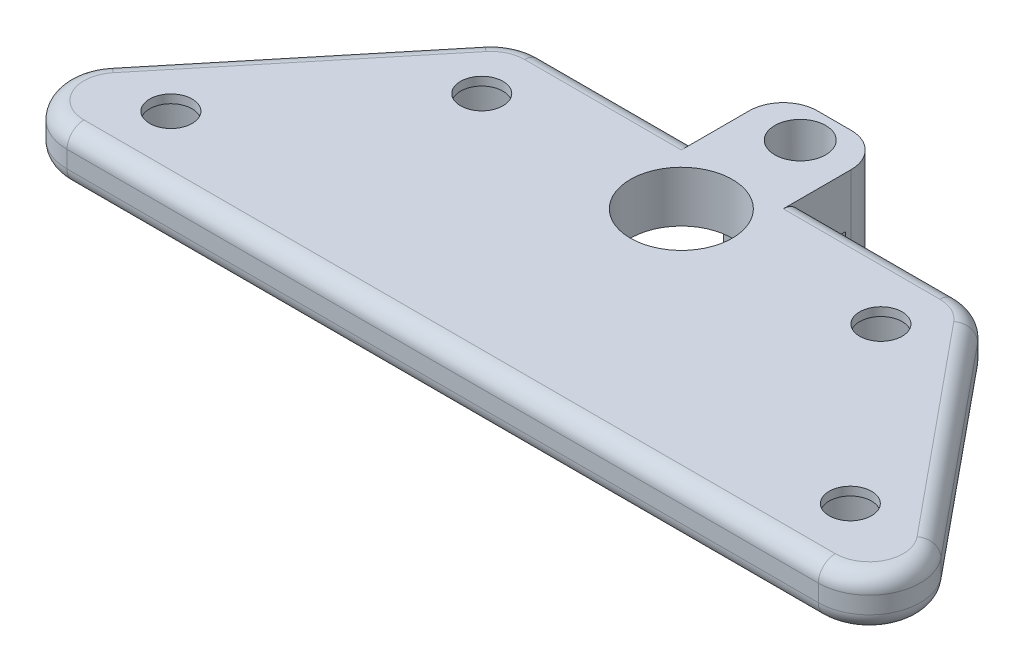
from build123d import *
from build123d.topology import SkipClean

# Parameters (mm, degrees)
SKETCH1_R           = 3
SKETCH1_R_2         = 2.6
SKETCH1_R_3         = 1.5
BOSS_EXTRUDE1_DEPTH = 3
BOSS_EXTRUDE3_START = -0.5
SKETCH3_R           = 2.6
SKETCH3_R_2         = 1.25
BOSS_EXTRUDE3_DEPTH = 0.5
BOSS_EXTRUDE4_START = 3.4
SKETCH4_R           = 1.5
BOSS_EXTRUDE4_DEPTH = 3.4
FILLET1_R           = 1
SKETCH5_R           = 11
CUT_EXTRUDE1_DEPTH  = 3.4


with BuildPart() as part:
    # Sketch1 → Boss-Extrude1 (new body)
    with BuildSketch(Plane(origin=(0, 0, 0), x_dir=(1, 0, 0), z_dir=(0, 1, 0))):
        with BuildLine():
            Line((-14.54167044, 2.903480135), (-24.433461485, -9.146519865))
            ThreePointArc((-24.433461485, -9.146519865), (-24.826727515, -12.332489687), (-22.114676593, -14.05))
            Line((-22.114676593, -14.05), (22.114676593, -14.05))
            ThreePointArc((22.114676593, -14.05), (24.826727515, -12.332489687), (24.433461485, -9.146519865))
            Line((24.433461485, -9.146519865), (14.54167044, 2.903480135))
            ThreePointArc((14.54167044, 2.903480135), (13.505375235, 3.712050922), (12.222885548, 4))
            Line((12.222885548, 4), (3, 4))
            Line((3, 4), (3, 7))
            ThreePointArc((3, 7), (2.414213562, 8.414213562), (1, 9))
            Line((1, 9), (-1, 9))
            ThreePointArc((-1, 9), (-2.414213562, 8.414213562), (-3, 7))
            Line((-3, 7), (-3, 4))
            Line((-3, 4), (-12.222885548, 4))
            ThreePointArc((-12.222885548, 4), (-13.505375235, 3.712050922), (-14.54167044, 2.903480135))
        make_face()
        with Locations(Location((0, 0, 0), (0, 0, 270))):
            Circle(SKETCH1_R, mode=Mode.SUBTRACT)
        with Locations(Location((11.75, 0, 0), (0, 0, 270))):
            Circle(SKETCH1_R_2, mode=Mode.SUBTRACT)
        with Locations(Location((20, -10.05, 0), (0, 0, 270))):
            Circle(SKETCH1_R_2, mode=Mode.SUBTRACT)
        with Locations(Location((-20, -10.05, 0), (0, 0, 90))):
            Circle(SKETCH1_R_2, mode=Mode.SUBTRACT)
        with Locations(Location((-11.75, 0, 0), (0, 0, 90))):
            Circle(SKETCH1_R_2, mode=Mode.SUBTRACT)
        with Locations(Location((0, 7, 0), (0, 0, 270))):
            Circle(SKETCH1_R_3, mode=Mode.SUBTRACT)
    extrude(amount=BOSS_EXTRUDE1_DEPTH)

    # Sketch3 → Boss-Extrude3 (add)
    # profile 1 of 4: a face of its own
    with BuildSketch(Plane(origin=(0, 3, 0), x_dir=(1, 0, 0), z_dir=(0, 1, 0)).offset(BOSS_EXTRUDE3_START)):
        with Locations(Location((-11.75, 0, 0), (0, 0, 90))):
            Circle(SKETCH3_R)
        with Locations(Location((-11.75, 0, 0), (0, 0, 270))):
            Circle(SKETCH3_R_2, mode=Mode.SUBTRACT)
    # profile 2 of 4: a face of its own
    with BuildSketch(Plane(origin=(0, 3, 0), x_dir=(1, 0, 0), z_dir=(0, 1, 0)).offset(BOSS_EXTRUDE3_START)):
        with Locations(Location((-20, -10.05, 0), (0, 0, 90))):
            Circle(SKETCH3_R)
        with Locations(Location((-20, -10.05, 0), (0, 0, 270))):
            Circle(SKETCH3_R_2, mode=Mode.SUBTRACT)
    # profile 3 of 4: a face of its own
    with BuildSketch(Plane(origin=(0, 3, 0), x_dir=(1, 0, 0), z_dir=(0, 1, 0)).offset(BOSS_EXTRUDE3_START)):
        with Locations(Location((11.75, 0, 0), (0, 0, 270))):
            Circle(SKETCH3_R)
        with Locations(Location((11.75, 0, 0), (0, 0, 270))):
            Circle(SKETCH3_R_2, mode=Mode.SUBTRACT)
    # profile 4 of 4: a face of its own
    with BuildSketch(Plane(origin=(0, 3, 0), x_dir=(1, 0, 0), z_dir=(0, 1, 0)).offset(BOSS_EXTRUDE3_START)):
        with Locations(Location((20, -10.05, 0), (0, 0, 270))):
            Circle(SKETCH3_R)
        with Locations(Location((20, -10.05, 0), (0, 0, 270))):
            Circle(SKETCH3_R_2, mode=Mode.SUBTRACT)
    extrude(amount=BOSS_EXTRUDE3_DEPTH)

    # Sketch4 → Boss-Extrude4 (add)
    with SkipClean():  # the faces are left unmerged after this step: merging them gives an invalid solid
        with BuildSketch(Plane(origin=(0, 0, 0), x_dir=(-1, 0, 0), z_dir=(0, -1, 0)).offset(BOSS_EXTRUDE4_START)):
            with BuildLine():
                Line((-3, 4), (-3, 7))
                ThreePointArc((-3, 7), (-2.414213562, 8.414213562), (-1, 9))
                Line((-1, 9), (1, 9))
                ThreePointArc((1, 9), (2.414213562, 8.414213562), (3, 7))
                Line((3, 7), (3, 4))
                Line((3, 4), (-3, 4))
            make_face()
            with Locations(Location((0, 7, 0), (0, 0, 90))):
                Circle(SKETCH4_R, mode=Mode.SUBTRACT)
        extrude(amount=-BOSS_EXTRUDE4_DEPTH)

    # Fillet1
    # the kernel refuses this fillet: 1 mm, written as the material it takes off along each edge
    with BuildSketch(Plane(origin=(-22.114676593, 3, 11.05), x_dir=(-0.772928297309301, 0, -0.6344933783882578), z_dir=(0.6344933783882578, 0, -0.772928297309301))) as fillet1_piece_1:
        with BuildLine():
            CenterArc((3 - FILLET1_R, -FILLET1_R), FILLET1_R, 0, 90)
            Line((3, -FILLET1_R), (3, 0))
            Line((3, 0), (3 - FILLET1_R, 0))
        make_face()
    revolve(axis=Axis((-22.114676593, 3, 11.05), (0, 1, 0)), revolution_arc=129.38241941, mode=Mode.SUBTRACT)
    with BuildSketch(Plane(origin=(-3, 0, -4), x_dir=(0, 1, 0), z_dir=(-1, 0, 0)), Plane(origin=(12.222885548, 3, -4), x_dir=(0, 0, 1), z_dir=(-1, 0, 0))) as fillet1_piece_2:
        with BuildLine():
            CenterArc((FILLET1_R, -FILLET1_R), FILLET1_R, 90, 90)
            Line((0, -FILLET1_R), (0, 0))
            Line((0, 0), (FILLET1_R, 0))
        make_face()
    extrude(amount=9.222885548, mode=Mode.SUBTRACT)
    with BuildSketch(Plane(origin=(12.222885548, 0, -4), x_dir=(0, 0, 1), z_dir=(-1, 0, 0)), Plane(origin=(-3, 3, -4), x_dir=(0, -1, 0), z_dir=(-1, 0, 0))) as fillet1_piece_3:
        with BuildLine():
            CenterArc((FILLET1_R, FILLET1_R), FILLET1_R, 180, 90)
            Line((0, FILLET1_R), (0, 0))
            Line((0, 0), (FILLET1_R, 0))
        make_face()
    extrude(amount=9.222885548, mode=Mode.SUBTRACT)
    with BuildSketch(Plane(origin=(12.222885548, 0, -1), x_dir=(0.7729282973093169, 0, -0.6344933783882384), z_dir=(0.6344933783882384, 0, 0.7729282973093169))) as fillet1_piece_4:
        with BuildLine():
            CenterArc((3 - FILLET1_R, FILLET1_R), FILLET1_R, 270, 90)
            Line((3, FILLET1_R), (3, 0))
            Line((3, 0), (3 - FILLET1_R, 0))
        make_face()
    revolve(axis=Axis((12.222885548, 0, -1), (0, 1, 0)), revolution_arc=50.61758059, mode=Mode.SUBTRACT)
    with BuildSketch(Plane(origin=(-22.114676593, 3, 14.05), x_dir=(0, 0, -1), z_dir=(1, 0, 0))) as fillet1_piece_5:
        with BuildLine():
            CenterArc((FILLET1_R, -FILLET1_R), FILLET1_R, 90, 90)
            Line((0, -FILLET1_R), (0, 0))
            Line((0, 0), (FILLET1_R, 0))
        make_face()
    extrude(amount=44.229353186, mode=Mode.SUBTRACT)
    with BuildSketch(Plane(origin=(24.433461485, 0, 9.146519865), x_dir=(-0.7729282973093136, 0, 0.6344933783882426), z_dir=(-0.6344933783882426, 0, -0.7729282973093136)), Plane(origin=(-14.54167044, 3, -2.903480135), x_dir=(0, -1, 0), z_dir=(-0.6344933783882424, 0, 0.7729282973093137))) as fillet1_piece_6:
        with BuildLine():
            CenterArc((FILLET1_R, FILLET1_R), FILLET1_R, 180, 90)
            Line((0, FILLET1_R), (0, 0))
            Line((0, 0), (FILLET1_R, 0))
        make_face()
    extrude(amount=15.590061901, mode=Mode.SUBTRACT)
    with BuildSketch(Plane(origin=(22.114676593, 0, 11.05), x_dir=(0, 0, 1), z_dir=(-1, 0, 0))) as fillet1_piece_7:
        with BuildLine():
            CenterArc((3 - FILLET1_R, FILLET1_R), FILLET1_R, 270, 90)
            Line((3, FILLET1_R), (3, 0))
            Line((3, 0), (3 - FILLET1_R, 0))
        make_face()
    revolve(axis=Axis((22.114676593, 0, 11.05), (0, 1, 0)), revolution_arc=129.38241941, mode=Mode.SUBTRACT)
    with BuildSketch(Plane(origin=(-22.114676593, 0, 14.05), x_dir=(0, 0, -1), z_dir=(1, 0, 0))) as fillet1_piece_8:
        with BuildLine():
            CenterArc((FILLET1_R, FILLET1_R), FILLET1_R, 180, 90)
            Line((0, FILLET1_R), (0, 0))
            Line((0, 0), (FILLET1_R, 0))
        make_face()
    extrude(amount=44.229353186, mode=Mode.SUBTRACT)
    with BuildSketch(Plane(origin=(-22.114676593, 0, 11.05), x_dir=(-0.772928297309301, 0, -0.6344933783882578), z_dir=(0.6344933783882578, 0, -0.772928297309301))) as fillet1_piece_9:
        with BuildLine():
            CenterArc((3 - FILLET1_R, FILLET1_R), FILLET1_R, 270, 90)
            Line((3, FILLET1_R), (3, 0))
            Line((3, 0), (3 - FILLET1_R, 0))
        make_face()
    revolve(axis=Axis((-22.114676593, 0, 11.05), (0, 1, 0)), revolution_arc=129.38241941, mode=Mode.SUBTRACT)
    with BuildSketch(Plane(origin=(-14.54167044, 0, -2.903480135), x_dir=(0, 1, 0), z_dir=(-0.6344933783882424, 0, 0.7729282973093137)), Plane(origin=(24.433461485, 3, 9.146519865), x_dir=(-0.7729282973093136, 0, 0.6344933783882426), z_dir=(-0.6344933783882426, 0, -0.7729282973093136))) as fillet1_piece_10:
        with BuildLine():
            CenterArc((FILLET1_R, -FILLET1_R), FILLET1_R, 90, 90)
            Line((0, -FILLET1_R), (0, 0))
            Line((0, 0), (FILLET1_R, 0))
        make_face()
    extrude(amount=15.590061901, mode=Mode.SUBTRACT)
    with BuildSketch(Plane(origin=(-12.222885548, 0, -1), x_dir=(0, 0, -1), z_dir=(1, 0, 0))) as fillet1_piece_11:
        with BuildLine():
            CenterArc((3 - FILLET1_R, FILLET1_R), FILLET1_R, 270, 90)
            Line((3 - FILLET1_R, 0), (3, 0))
            Line((3, 0), (3, FILLET1_R))
        make_face()
    revolve(axis=Axis((-12.222885548, 0, -1), (0, 1, 0)), revolution_arc=50.61758059, mode=Mode.SUBTRACT)
    with BuildSketch(Plane(origin=(22.114676593, 3, 11.05), x_dir=(0, 0, 1), z_dir=(-1, 0, 0))) as fillet1_piece_12:
        with BuildLine():
            CenterArc((3 - FILLET1_R, -FILLET1_R), FILLET1_R, 0, 90)
            Line((3, -FILLET1_R), (3, 0))
            Line((3, 0), (3 - FILLET1_R, 0))
        make_face()
    revolve(axis=Axis((22.114676593, 3, 11.05), (0, 1, 0)), revolution_arc=129.38241941, mode=Mode.SUBTRACT)
    with BuildSketch(Plane(origin=(12.222885548, 3, -1), x_dir=(0.7729282973093169, 0, -0.6344933783882384), z_dir=(0.6344933783882384, 0, 0.7729282973093169))) as fillet1_piece_13:
        with BuildLine():
            CenterArc((3 - FILLET1_R, -FILLET1_R), FILLET1_R, 0, 90)
            Line((3, -FILLET1_R), (3, 0))
            Line((3, 0), (3 - FILLET1_R, 0))
        make_face()
    revolve(axis=Axis((12.222885548, 3, -1), (0, 1, 0)), revolution_arc=50.61758059, mode=Mode.SUBTRACT)
    with BuildSketch(Plane(origin=(-12.222885548, 3, -1), x_dir=(0, 0, -1), z_dir=(1, 0, 0))) as fillet1_piece_14:
        with BuildLine():
            CenterArc((3 - FILLET1_R, -FILLET1_R), FILLET1_R, 0, 90)
            Line((3 - FILLET1_R, 0), (3, 0))
            Line((3, 0), (3, -FILLET1_R))
        make_face()
    revolve(axis=Axis((-12.222885548, 3, -1), (0, 1, 0)), revolution_arc=50.61758059, mode=Mode.SUBTRACT)

    # Sketch5 → Cut-Extrude1 (cut)
    with BuildSketch(Plane(origin=(0, -3.4, 0), x_dir=(-1, 0, 0), z_dir=(0, -1, 0))):
        with Locations((-11.75, 0)):
            Circle(SKETCH5_R)
        with Locations((11.75, 0)):
            Circle(SKETCH5_R)
    extrude(amount=-CUT_EXTRUDE1_DEPTH, mode=Mode.SUBTRACT)


solid = part.part
